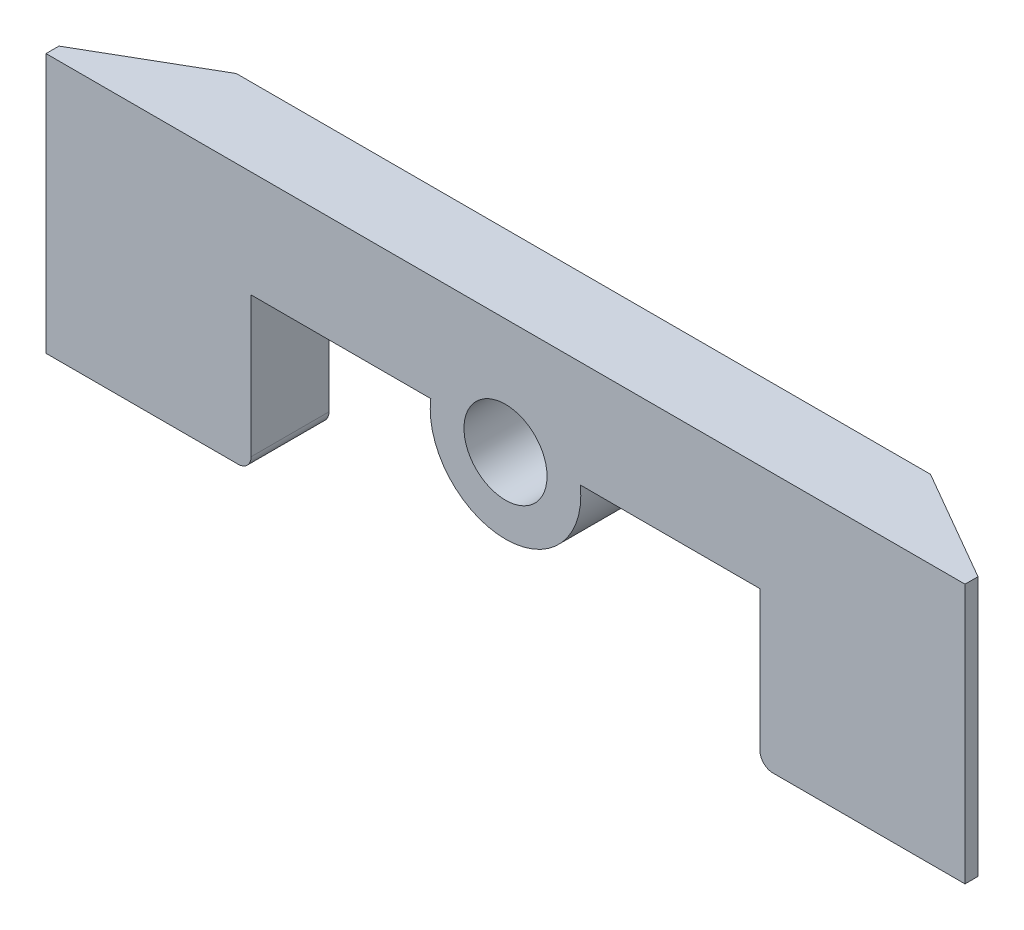
from build123d import *

# Parameters (mm, degrees)
SKETCH2_R           = 1.6
BOSS_EXTRUDE2_DEPTH = 3
FILLET1_R           = 2.5
CUT_EXTRUDE1_DEPTH  = 20
FILLET2_R           = 0.5


with BuildPart() as part:
    # Sketch2 → Boss-Extrude2 (new body)
    with BuildSketch(Plane.XY):
        with BuildLine():
            Line((9.8, 0.9), (9.8, -5))
            Line((9.8, -5), (17.7, -5))
            Line((17.7, -5), (17.7, 5))
            Line((17.7, 5), (-17.7, 5))
            Line((-17.7, 5), (-17.7, -5))
            Line((-17.7, -5), (-9.8, -5))
            Line((-9.8, -5), (-9.8, 0.9))
            Line((-9.8, 0.9), (-2.878801834, 0.9))
            ThreePointArc((-2.878801834, 0.9), (0, -2.35), (2.878801834, 0.9))
            Line((2.878801834, 0.9), (9.8, 0.9))
        make_face()
        with Locations((0, 0.55)):
            Circle(SKETCH2_R, mode=Mode.SUBTRACT)
    extrude(amount=BOSS_EXTRUDE2_DEPTH)

    # Fillet1
    fillet1_edges = [part.edges().sort_by_distance(p)[0] for p in [
        (-6.339400917, 0.9, 0),
        (6.339400917, 0.9, 0),
    ]]
    fillet(fillet1_edges, radius=FILLET1_R)

    # Sketch4 → Cut-Extrude1 (cut)
    with BuildSketch(Plane(origin=(0, 5, 0), x_dir=(1, 0, 0), z_dir=(0, 1, 0))):
        Polygon((-13.369872981, 0), (-17.7, 0), (-17.7, -2.5), align=None)
        Polygon((17.7, 0), (13.369872981, 0), (17.7, -2.5), align=None)
    extrude(amount=-CUT_EXTRUDE1_DEPTH, mode=Mode.SUBTRACT)

    # Fillet2
    fillet2_edges = [part.edges().sort_by_distance(p)[0] for p in [
        (9.8, -5, 1.5),
        (-9.8, -5, 1.5),
    ]]
    fillet(fillet2_edges, radius=FILLET2_R)


solid = part.part
